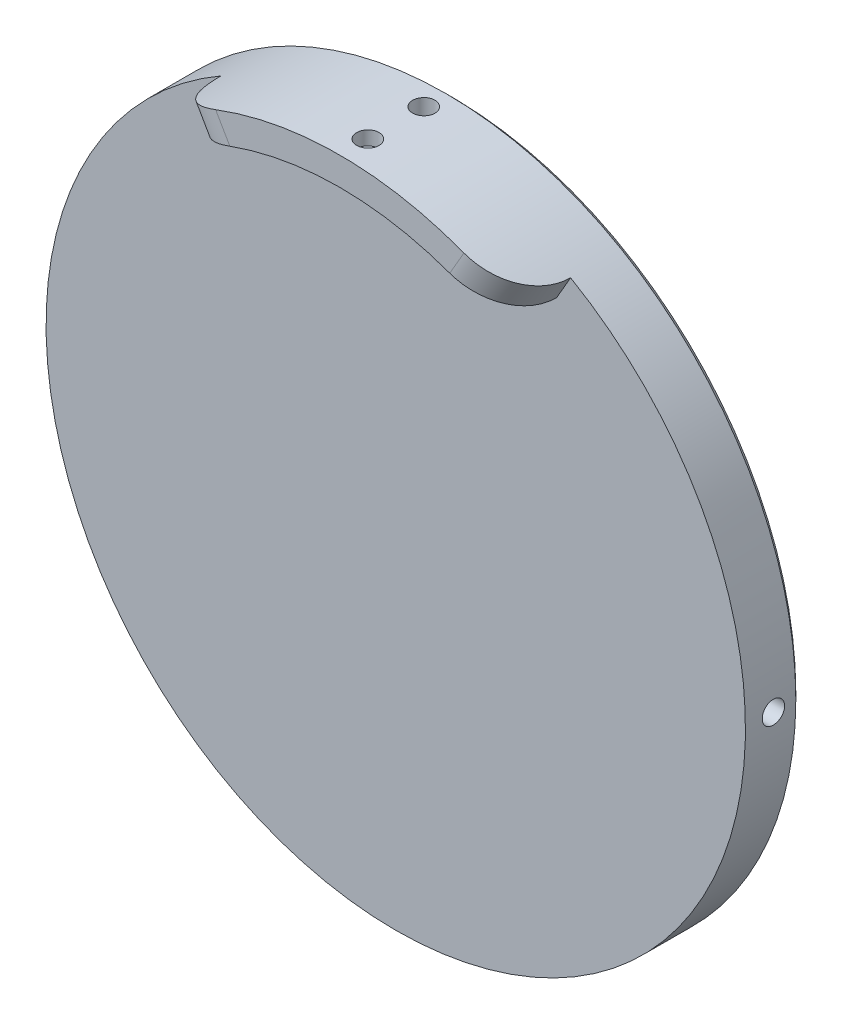
from build123d import *

# Parameters (mm, degrees)
SKETCH1_R           = 62.5
BOSS_EXTRUDE1_DEPTH = 5
CUT_EXTRUDE1_START  = 55
SKETCH2_R           = 2
CUT_EXTRUDE1_DEPTH  = 10
CUT_EXTRUDE2_START  = -65
SKETCH2_2_R         = 2
CUT_EXTRUDE2_DEPTH  = 10
CUT_EXTRUDE3_START  = 55
SKETCH3_R           = 2
CUT_EXTRUDE3_DEPTH  = 10
CUT_EXTRUDE4_START  = -65
SKETCH3_2_R         = 2
CUT_EXTRUDE4_DEPTH  = 10
BOSS_EXTRUDE2_START = 10
BOSS_EXTRUDE2_DEPTH = 10
FILLET1_R           = 10
CUT_EXTRUDE5_START  = 60
SKETCH6_R           = 2
CUT_EXTRUDE5_DEPTH  = 10
CHAMFER1_SIZE       = 1


with BuildPart() as part:
    # Sketch1 → Boss-Extrude1 (new, symmetric)
    with BuildSketch(Plane.XY):
        Circle(SKETCH1_R)
    extrude(amount=BOSS_EXTRUDE1_DEPTH, both=True)

    # Sketch2 → Cut-Extrude1 (cut)
    with BuildSketch(Plane(origin=(0, 0, 0), x_dir=(1, 0, 0), z_dir=(0, 1, 0)).offset(CUT_EXTRUDE1_START)):
        with Locations(Location((0, 0, 0), (0, 0, 90))):
            Circle(SKETCH2_R)
    extrude(amount=CUT_EXTRUDE1_DEPTH, mode=Mode.SUBTRACT)

    # Sketch2<2> → Cut-Extrude2 (cut)
    with BuildSketch(Plane(origin=(0, 0, 0), x_dir=(1, 0, 0), z_dir=(0, 1, 0)).offset(CUT_EXTRUDE2_START)):
        with Locations(Location((0, 0, 0), (0, 0, 90))):
            Circle(SKETCH2_2_R)
    extrude(amount=CUT_EXTRUDE2_DEPTH, mode=Mode.SUBTRACT)

    # Sketch3 → Cut-Extrude3 (cut)
    with BuildSketch(Plane(origin=(0, 0, 0), x_dir=(0, 0, -1), z_dir=(1, 0, 0)).offset(CUT_EXTRUDE3_START)):
        Circle(SKETCH3_R)
    extrude(amount=CUT_EXTRUDE3_DEPTH, mode=Mode.SUBTRACT)

    # Sketch3<2> → Cut-Extrude4 (cut)
    with BuildSketch(Plane(origin=(0, 0, 0), x_dir=(0, 0, -1), z_dir=(1, 0, 0)).offset(CUT_EXTRUDE4_START)):
        Circle(SKETCH3_2_R)
    extrude(amount=CUT_EXTRUDE4_DEPTH, mode=Mode.SUBTRACT)

    # Sketch4 → Boss-Extrude2 (add)
    with BuildSketch(Plane.XY.offset(5).offset(BOSS_EXTRUDE2_START)):
        with BuildLine():
            Line((-31.25, 54.126587737), (-28.75, 49.796460718))
            ThreePointArc((-28.75, 49.796460718), (0, 57.5), (28.75, 49.796460718))
            Line((28.75, 49.796460718), (31.25, 54.126587737))
            ThreePointArc((31.25, 54.126587737), (0, 62.5), (-31.25, 54.126587737))
        make_face()
    extrude(amount=-BOSS_EXTRUDE2_DEPTH)

    # Fillet1
    fillet1_edges = [part.edges().sort_by_distance(p)[0] for p in [
        (-30, 51.961524227, 15),
        (30, 51.961524227, 15),
    ]]
    fillet(fillet1_edges, radius=FILLET1_R - 0.0001)  # a hair under: the kernel refuses the full size

    # Sketch6 → Cut-Extrude5 (cut)
    with BuildSketch(Plane(origin=(0, 0, 0), x_dir=(1, 0, 0), z_dir=(0, 1, 0)).offset(CUT_EXTRUDE5_START)):
        with Locations(Location((0, -10, 0), (0, 0, 90))):
            Circle(SKETCH6_R)
    extrude(amount=CUT_EXTRUDE5_DEPTH, mode=Mode.SUBTRACT)

    # Chamfer1
    chamfer1_edges = [part.edges().sort_by_distance(p)[0] for p in [
        (-62.5, 0, -5),
    ]]
    chamfer(chamfer1_edges, length=CHAMFER1_SIZE)


solid = part.part
